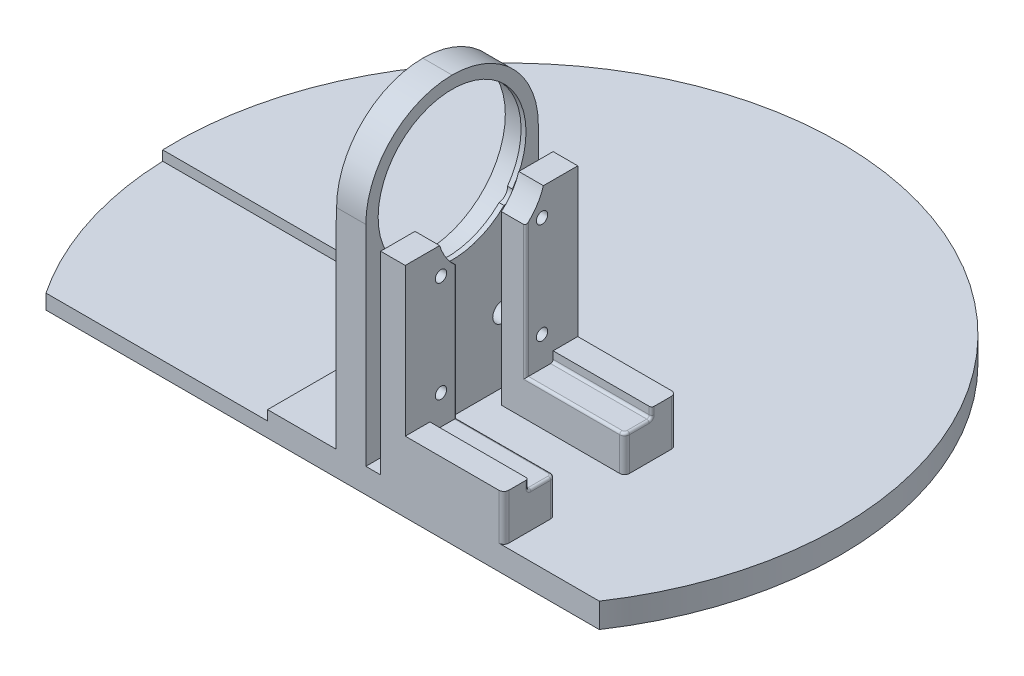
from build123d import *

# Parameters (mm, degrees)
SKETCH_1_R           = 67.5
EXTRUDE_1_DEPTH      = 5
SKETCH_2_W           = 6
SKETCH_2_H           = 35
EXTRUDE_2_DEPTH      = 60
FILLET_1_R           = 17.5
SKETCH_3_R           = 16
CUT_EXTRUDE_1_DEPTH  = 5
CHAMFER_1_SIZE       = 1.640243073
CHAMFER_1_SIZE_2     = 0.8
SKETCH_4_R           = 15
CUT_EXTRUDE_2_DEPTH  = 121.188675061
SKETCH_6_W           = 2
SKETCH_6_H           = 6
CUT_EXTRUDE_3_DEPTH  = 121.817372977
SKETCH_8_R           = 1.6
CUT_EXTRUDE_5_DEPTH  = 6
CUT_EXTRUDE_START    = -2
CUT_EXTRUDE_8_DEPTH  = 2.2
SKETCH_11_W          = 25
SKETCH_11_H          = 10.5
EXTRUDE_4_DEPTH      = 7.3
EXTRUDE_5_DEPTH      = 2
FILLET_3_R           = 1
EXTRUDE_6_DEPTH      = 5
SKETCH_14_R          = 1.15
CUT_EXTRUDE_10_DEPTH = 127.019830237
FILLET_2_R           = 0.5
SKETCH_15_R          = 2
CUT_EXTRUDE_11_DEPTH = 10
SKETCH_16_W          = 56.328401117
SKETCH_16_H          = 65
CUT_EXTRUDE_12_DEPTH = 2
SKETCH_17_W          = 112.249721604
SKETCH_17_H          = 30
CUT_EXTRUDE_13_DEPTH = 113.749722891


# Some blends are built 0.0001 mm under size
with BuildPart() as part:
    # 스케치1 → 보스-돌출1 (new body)
    with BuildSketch(Plane(origin=(0, 0, 0), x_dir=(1, 0, 0), z_dir=(0, 1, 0))):
        with Locations(Location((0, 0, 0), (0, 0, 270))):
            Circle(SKETCH_1_R)
    extrude(amount=EXTRUDE_1_DEPTH)

    # 스케치2 → 보스-돌출2 (add)
    with BuildSketch(Plane(origin=(0, 5, 0), x_dir=(1, 0, 0), z_dir=(0, 1, 0))):
        with Locations((5.76, -20)):
            Rectangle(SKETCH_2_W, SKETCH_2_H)
    extrude(amount=EXTRUDE_2_DEPTH)

    # 필렛1
    fillet_1_edges = [part.edges().sort_by_distance(p)[0] for p in [
        (5.76, 65, 2.5),
        (5.76, 65, 37.5),
    ]]
    fillet(fillet_1_edges, radius=FILLET_1_R - 0.0001)  # a hair under: the kernel refuses the full size

    # 스케치3 → 컷-돌출1 (cut)
    with BuildSketch(Plane.ZY.offset(-2.76)):
        with Locations((20, 47.5)):
            Circle(SKETCH_3_R)
    extrude(amount=-CUT_EXTRUDE_1_DEPTH, mode=Mode.SUBTRACT)

    # 모따기1
    # the kernel refuses this chamfer: 1.640243073, 0.8 mm, written as the material it takes off along each edge
    with BuildSketch(Plane(origin=(2.76, 47.5, 20), x_dir=(0, 0, 1), z_dir=(0, -1, 0))) as chamfer_1_piece_1:
        Polygon((16 + CHAMFER_1_SIZE, 0), (16, -CHAMFER_1_SIZE_2), (16, 0), align=None)
    revolve(axis=Axis((2.76, 47.5, 20), (-1, 0, 0)), mode=Mode.SUBTRACT)

    # 스케치4 → 컷-돌출2 (cut, through all)
    with BuildSketch(Plane.ZY.offset(-7.76)):
        with Locations((20, 47.5)):
            Circle(SKETCH_4_R)
    extrude(amount=-CUT_EXTRUDE_2_DEPTH, mode=Mode.SUBTRACT)

    # 스케치6 → 컷-돌출3 (cut, through all)
    with BuildSketch(Plane(origin=(8.76, 0, 0), x_dir=(0, 0, -1), z_dir=(1, 0, 0))):
        with Locations((-3.5, 24.5)):
            Rectangle(SKETCH_6_W, SKETCH_6_H)
    extrude(amount=-CUT_EXTRUDE_3_DEPTH, mode=Mode.SUBTRACT)

    # 스케치8 → 컷-돌출5 (cut)
    with BuildSketch(Plane(origin=(0, 0, 4.5), x_dir=(-1, 0, 0), z_dir=(0, 0, -1))):
        with Locations((-5.76, 24.5)):
            Circle(SKETCH_8_R)
    extrude(amount=-CUT_EXTRUDE_5_DEPTH, mode=Mode.SUBTRACT)

    # 스케치9 → 컷-돌출8 (cut)
    with BuildSketch(Plane(origin=(0, 0, 4.5), x_dir=(-1, 0, 0), z_dir=(0, 0, -1)).offset(CUT_EXTRUDE_START)):
        Polygon((-4.316624327, 27), (-7.203375673, 27), (-8.646751346, 24.5), (-7.203375673, 22), (-4.316624327, 22), (-2.76, 22), (-2.76, 27), align=None)
    extrude(amount=-CUT_EXTRUDE_8_DEPTH, mode=Mode.SUBTRACT)

    # 스케치11 → 보스-돌출4 (add)
    with BuildSketch(Plane(origin=(0, 5, 0), x_dir=(1, 0, 0), z_dir=(0, 1, 0))):
        with Locations((24.26, -7.75)):
            Rectangle(SKETCH_11_W, SKETCH_11_H)
        with Locations((24.26, -32.25)):
            Rectangle(SKETCH_11_W, SKETCH_11_H)
    extrude(amount=EXTRUDE_4_DEPTH)

    # 스케치12 → 보스-돌출5 (add)
    with BuildSketch(Plane(origin=(0, 12.3, 0), x_dir=(1, 0, 0), z_dir=(0, 1, 0))):
        Polygon((16.76, -32.5), (36.76, -32.5), (36.76, -37.5), (11.76, -37.5), (11.76, -27), (16.76, -27), align=None)
        Polygon((11.76, -2.5), (36.76, -2.5), (36.76, -7.5), (16.76, -7.5), (16.76, -13), (11.76, -13), align=None)
    extrude(amount=EXTRUDE_5_DEPTH)

    # 필렛3
    fillet_3_edges = [part.edges().sort_by_distance(p)[0] for p in [
        (36.76, 9.65, 2.5),
        (36.76, 9.65, 37.5),
        (36.76, 8.65, 27),
        (36.76, 8.65, 13),
    ]]
    fillet(fillet_3_edges, radius=FILLET_3_R)

    # 스케치13 → 보스-돌출6 (add)
    with BuildSketch(Plane(origin=(16.76, 0, 0), x_dir=(0, 0, -1), z_dir=(1, 0, 0))):
        with BuildLine():
            Line((-27, 14.3), (-37.5, 14.3))
            Line((-37.5, 14.3), (-37.5, 44.3))
            Line((-37.5, 44.3), (-30.524257694, 44.3))
            ThreePointArc((-30.524257694, 44.3), (-29.151964364, 41.397414624), (-27, 39.014718626))
            Line((-27, 39.014718626), (-27, 14.3))
        make_face()
        with BuildLine():
            Line((-13, 14.3), (-2.5, 14.3))
            Line((-2.5, 14.3), (-2.5, 44.3))
            Line((-2.5, 44.3), (-9.475742306, 44.3))
            ThreePointArc((-9.475742306, 44.3), (-10.848035636, 41.397414624), (-13, 39.014718626))
            Line((-13, 39.014718626), (-13, 14.3))
        make_face()
    extrude(amount=-EXTRUDE_6_DEPTH)

    # 스케치14 → 컷-돌출10 (cut, through all)
    with BuildSketch(Plane(origin=(16.76, 0, 0), x_dir=(0, 0, -1), z_dir=(1, 0, 0))):
        with Locations((-30.25, 18.3)):
            Circle(SKETCH_14_R)
        with Locations((-9.75, 18.3)):
            Circle(SKETCH_14_R)
        with Locations((-9.75, 38.8)):
            Circle(SKETCH_14_R)
        with Locations((-30.25, 38.8)):
            Circle(SKETCH_14_R)
    extrude(amount=-CUT_EXTRUDE_10_DEPTH, mode=Mode.SUBTRACT)

    # 필렛2
    fillet_2_edges = [part.edges().sort_by_distance(p)[0] for p in [
        (26.26, 12.3, 13),
        (16.76, 25.657359313, 13),
        (26.76, 12.3, 7.5),
        (36.76, 13.3, 7.5),
        (36.76, 12.3, 30.25),
        (16.76, 25.657359313, 27),
        (26.76, 12.3, 32.5),
        (36.76, 13.3, 32.5),
        (26.26, 12.3, 27),
        (36.467106781, 12.3, 27.292893219),
        (36.76, 12.3, 9.75),
        (36.467106781, 12.3, 12.707106781),
    ]]
    fillet(fillet_2_edges, radius=FILLET_2_R)

    # 스케치15 → 컷-돌출11 (cut)
    with BuildSketch(Plane.ZY.offset(-2.76)):
        with Locations((9.75, 38.8)):
            Circle(SKETCH_15_R)
        with Locations((30.25, 38.8)):
            Circle(SKETCH_15_R)
        with Locations((9.75, 18.3)):
            Circle(SKETCH_15_R)
        with Locations((30.25, 18.3)):
            Circle(SKETCH_15_R)
    extrude(amount=-CUT_EXTRUDE_11_DEPTH, mode=Mode.SUBTRACT)

    # 스케치16 → 컷-돌출12 (cut)
    with BuildSketch(Plane(origin=(0, 5, 0), x_dir=(1, 0, 0), z_dir=(0, 1, 0))):
        with Locations((-39.335799442, -35)):
            Rectangle(SKETCH_16_W, SKETCH_16_H)
    extrude(amount=-CUT_EXTRUDE_12_DEPTH, mode=Mode.SUBTRACT)

    # 스케치17 → 컷-돌출13 (cut, through all)
    with BuildSketch(Plane(origin=(0, 5, 0), x_dir=(1, 0, 0), z_dir=(0, 1, 0))):
        with Locations((0, -52.5)):
            Rectangle(SKETCH_17_W, SKETCH_17_H)
    extrude(amount=-CUT_EXTRUDE_13_DEPTH, mode=Mode.SUBTRACT)


solid = part.part
